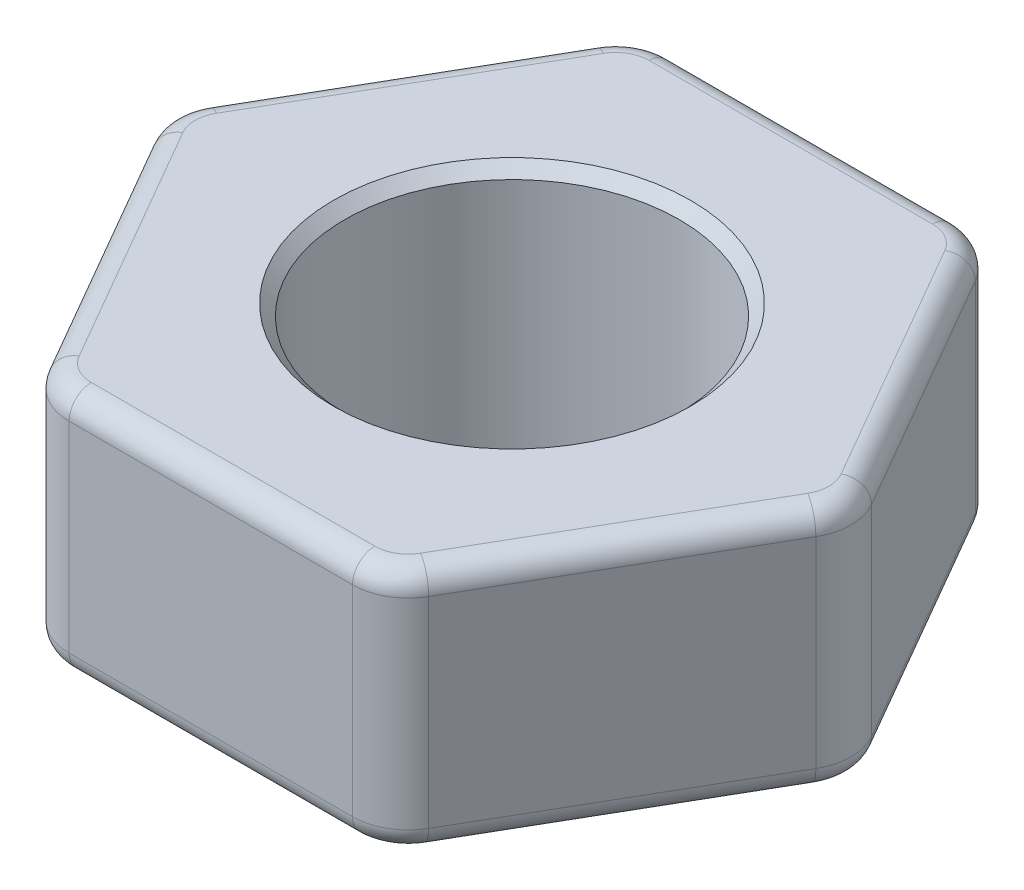
from build123d import *

# Parameters (mm, degrees)
BOSS_EXTRUDE1_DEPTH = 2.2
SKETCH2_R           = 1.5
CUT_EXTRUDE1_DEPTH  = 5.674398357
FILLET1_R           = 0.5
FILLET2_R           = 0.2
CHAMFER1_SIZE       = 0.1


with BuildPart() as part:
    # Sketch1 → Boss-Extrude1 (new body)
    with BuildSketch(Plane(origin=(0, 0, 0), x_dir=(1, 0, 0), z_dir=(0, 1, 0))):
        Polygon((3.117691454, 0), (1.558845727, 2.7), (-1.558845727, 2.7), (-3.117691454, 0), (-1.558845727, -2.7), (1.558845727, -2.7), align=None)
    extrude(amount=BOSS_EXTRUDE1_DEPTH)

    # Sketch2 → Cut-Extrude1 (cut, through all)
    with BuildSketch(Plane(origin=(0, 2.2, 0), x_dir=(1, 0, 0), z_dir=(0, 1, 0))):
        Circle(SKETCH2_R)
    extrude(amount=-CUT_EXTRUDE1_DEPTH, mode=Mode.SUBTRACT)

    # Fillet1
    fillet1_edges = [part.edges().sort_by_distance(p)[0] for p in [
        (-1.558845727, 1.1, 2.7),
        (-3.117691454, 1.1, 0),
        (-1.558845727, 1.1, -2.7),
        (1.558845727, 1.1, -2.7),
        (3.117691454, 1.1, 0),
        (1.558845727, 1.1, 2.7),
    ]]
    fillet(fillet1_edges, radius=FILLET1_R)

    # Fillet2
    fillet2_edges = [part.edges().sort_by_distance(p)[0] for p in [
        (-3.040341184, 0, 0),
        (-2.33826859, 0, -1.35),
        (-1.520170592, 0, -2.633012702),
        (0, 0, -2.7),
        (1.520170592, 0, -2.633012702),
        (2.33826859, 0, -1.35),
        (3.040341184, 0, 0),
        (2.33826859, 0, 1.35),
        (1.520170592, 0, 2.633012702),
        (0, 0, 2.7),
        (-1.520170592, 0, 2.633012702),
        (-1.520170592, 2.2, -2.633012702),
        (0, 2.2, -2.7),
        (1.520170592, 2.2, -2.633012702),
        (2.33826859, 2.2, -1.35),
        (3.040341184, 2.2, 0),
        (2.33826859, 2.2, 1.35),
        (1.520170592, 2.2, 2.633012702),
        (0, 2.2, 2.7),
        (-1.520170592, 2.2, 2.633012702),
        (-2.33826859, 2.2, 1.35),
        (-3.040341184, 2.2, 0),
        (-2.33826859, 0, 1.35),
        (-2.33826859, 2.2, -1.35),
    ]]
    fillet(fillet2_edges, radius=FILLET2_R)

    # Chamfer1
    chamfer1_edges = [part.edges().sort_by_distance(p)[0] for p in [
        (-1.5, 2.2, 0),
    ]]
    chamfer(chamfer1_edges, length=CHAMFER1_SIZE)


solid = part.part
